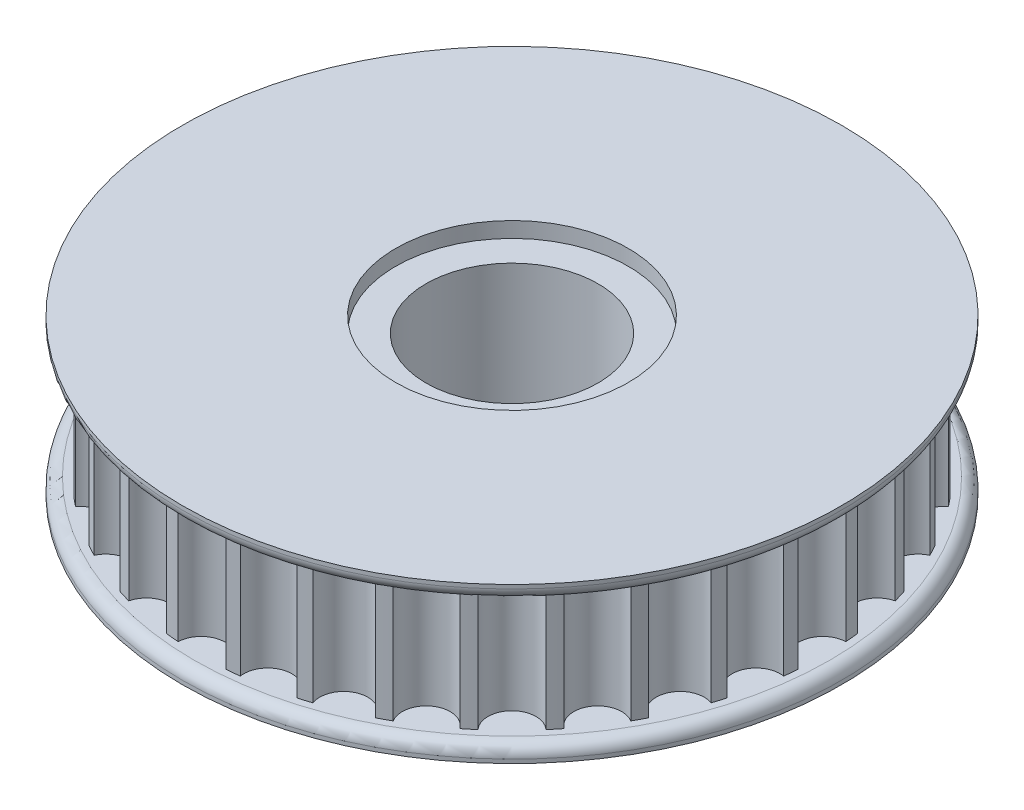
from build123d import *

# Parameters (mm, degrees)
SKETCH1_R           = 11.1
BOSS_EXTRUDE1_DEPTH = 8
SKETCH2_R           = 42.5
SKETCH2_R_2         = 15
BOSS_EXTRUDE2_DEPTH = 2
FILLET1_R           = 1.5


with BuildPart() as part:
    # Sketch1 → Boss-Extrude1 (new, symmetric)
    with BuildSketch(Plane(origin=(0, 0, 0), x_dir=(1, 0, 0), z_dir=(0, 1, 0))):
        with BuildLine():
            ThreePointArc((39.96011477, -3.097680993), (36.98, 0), (39.96011477, 3.097680993))
            ThreePointArc((39.96011477, 3.097680993), (39.887003845, 3.928526984), (39.796619952, 4.757671737))
            ThreePointArc((39.796619952, 4.757671737), (36.269439669, 7.214440108), (38.587964788, 10.833991579))
            ThreePointArc((38.587964788, 10.833991579), (38.354168656, 11.634609864), (38.103763348, 12.430189811))
            ThreePointArc((38.103763348, 12.430189811), (34.165065112, 14.151633329), (35.732900959, 18.153957945))
            ThreePointArc((35.732900959, 18.153957945), (35.347404275, 18.893581212), (34.946600487, 19.625022661))
            ThreePointArc((34.946600487, 19.625022661), (30.747746263, 20.544987217), (31.504641785, 24.776277888))
            ThreePointArc((31.504641785, 24.776277888), (30.982258971, 25.426482829), (30.446459367, 26.065676895))
            ThreePointArc((30.446459367, 26.065676895), (26.148808768, 26.148808768), (26.065676895, 30.446459367))
            ThreePointArc((26.065676895, 30.446459367), (25.426482829, 30.982258971), (24.776277888, 31.504641785))
            ThreePointArc((24.776277888, 31.504641785), (20.544987217, 30.747746263), (19.625022661, 34.946600487))
            ThreePointArc((19.625022661, 34.946600487), (18.893581212, 35.347404275), (18.153957945, 35.732900959))
            ThreePointArc((18.153957945, 35.732900959), (14.151633329, 34.165065112), (12.430189811, 38.103763348))
            ThreePointArc((12.430189811, 38.103763348), (11.634609864, 38.354168656), (10.833991579, 38.587964788))
            ThreePointArc((10.833991579, 38.587964788), (7.214440108, 36.269439669), (4.757671737, 39.796619952))
            ThreePointArc((4.757671737, 39.796619952), (3.928526984, 39.887003845), (3.097680993, 39.96011477))
            ThreePointArc((3.097680993, 39.96011477), (0, 36.98), (-3.097680993, 39.96011477))
            ThreePointArc((-3.097680993, 39.96011477), (-3.928526984, 39.887003845), (-4.757671737, 39.796619952))
            ThreePointArc((-4.757671737, 39.796619952), (-7.214440108, 36.269439669), (-10.833991579, 38.587964788))
            ThreePointArc((-10.833991579, 38.587964788), (-11.634609864, 38.354168656), (-12.430189811, 38.103763348))
            ThreePointArc((-12.430189811, 38.103763348), (-14.151633329, 34.165065112), (-18.153957945, 35.732900959))
            ThreePointArc((-18.153957945, 35.732900959), (-18.893581212, 35.347404275), (-19.625022661, 34.946600487))
            ThreePointArc((-19.625022661, 34.946600487), (-20.544987217, 30.747746263), (-24.776277888, 31.504641785))
            ThreePointArc((-24.776277888, 31.504641785), (-25.426482829, 30.982258971), (-26.065676895, 30.446459367))
            ThreePointArc((-26.065676895, 30.446459367), (-26.148808768, 26.148808768), (-30.446459367, 26.065676895))
            ThreePointArc((-30.446459367, 26.065676895), (-30.982258971, 25.426482829), (-31.504641785, 24.776277888))
            ThreePointArc((-31.504641785, 24.776277888), (-30.747746263, 20.544987217), (-34.946600487, 19.625022661))
            ThreePointArc((-34.946600487, 19.625022661), (-35.347404275, 18.893581212), (-35.732900959, 18.153957945))
            ThreePointArc((-35.732900959, 18.153957945), (-34.165065112, 14.151633329), (-38.103763348, 12.430189811))
            ThreePointArc((-38.103763348, 12.430189811), (-38.354168656, 11.634609864), (-38.587964788, 10.833991579))
            ThreePointArc((-38.587964788, 10.833991579), (-36.269439669, 7.214440108), (-39.796619952, 4.757671737))
            ThreePointArc((-39.796619952, 4.757671737), (-39.887003845, 3.928526984), (-39.96011477, 3.097680993))
            ThreePointArc((-39.96011477, 3.097680993), (-36.98, 0), (-39.96011477, -3.097680993))
            ThreePointArc((-39.96011477, -3.097680993), (-39.887003845, -3.928526984), (-39.796619952, -4.757671737))
            ThreePointArc((-39.796619952, -4.757671737), (-36.269439669, -7.214440108), (-38.587964788, -10.833991579))
            ThreePointArc((-38.587964788, -10.833991579), (-38.354168656, -11.634609864), (-38.103763348, -12.430189811))
            ThreePointArc((-38.103763348, -12.430189811), (-34.165065112, -14.151633329), (-35.732900959, -18.153957945))
            ThreePointArc((-35.732900959, -18.153957945), (-35.347404275, -18.893581212), (-34.946600487, -19.625022661))
            ThreePointArc((-34.946600487, -19.625022661), (-30.747746263, -20.544987217), (-31.504641785, -24.776277888))
            ThreePointArc((-31.504641785, -24.776277888), (-30.982258971, -25.426482829), (-30.446459367, -26.065676895))
            ThreePointArc((-30.446459367, -26.065676895), (-26.148808768, -26.148808768), (-26.065676895, -30.446459367))
            ThreePointArc((-26.065676895, -30.446459367), (-25.426482829, -30.982258971), (-24.776277888, -31.504641785))
            ThreePointArc((-24.776277888, -31.504641785), (-20.544987217, -30.747746263), (-19.625022661, -34.946600487))
            ThreePointArc((-19.625022661, -34.946600487), (-18.893581212, -35.347404275), (-18.153957945, -35.732900959))
            ThreePointArc((-18.153957945, -35.732900959), (-14.151633329, -34.165065112), (-12.430189811, -38.103763348))
            ThreePointArc((-12.430189811, -38.103763348), (-11.634609864, -38.354168656), (-10.833991579, -38.587964788))
            ThreePointArc((-10.833991579, -38.587964788), (-7.214440108, -36.269439669), (-4.757671737, -39.796619952))
            ThreePointArc((-4.757671737, -39.796619952), (-3.928526984, -39.887003845), (-3.097680993, -39.96011477))
            ThreePointArc((-3.097680993, -39.96011477), (0, -36.98), (3.097680993, -39.96011477))
            ThreePointArc((3.097680993, -39.96011477), (3.928526984, -39.887003845), (4.757671737, -39.796619952))
            ThreePointArc((4.757671737, -39.796619952), (7.214440108, -36.269439669), (10.833991579, -38.587964788))
            ThreePointArc((10.833991579, -38.587964788), (11.634609864, -38.354168656), (12.430189811, -38.103763348))
            ThreePointArc((12.430189811, -38.103763348), (14.151633329, -34.165065112), (18.153957945, -35.732900959))
            ThreePointArc((18.153957945, -35.732900959), (18.893581212, -35.347404275), (19.625022661, -34.946600487))
            ThreePointArc((19.625022661, -34.946600487), (20.544987217, -30.747746263), (24.776277888, -31.504641785))
            ThreePointArc((24.776277888, -31.504641785), (25.426482829, -30.982258971), (26.065676895, -30.446459367))
            ThreePointArc((26.065676895, -30.446459367), (26.148808768, -26.148808768), (30.446459367, -26.065676895))
            ThreePointArc((30.446459367, -26.065676895), (30.982258971, -25.426482829), (31.504641785, -24.776277888))
            ThreePointArc((31.504641785, -24.776277888), (30.747746263, -20.544987217), (34.946600487, -19.625022661))
            ThreePointArc((34.946600487, -19.625022661), (35.347404275, -18.893581212), (35.732900959, -18.153957945))
            ThreePointArc((35.732900959, -18.153957945), (34.165065112, -14.151633329), (38.103763348, -12.430189811))
            ThreePointArc((38.103763348, -12.430189811), (38.354168656, -11.634609864), (38.587964788, -10.833991579))
            ThreePointArc((38.587964788, -10.833991579), (36.269439669, -7.214440108), (39.796619952, -4.757671737))
            ThreePointArc((39.796619952, -4.757671737), (39.887003845, -3.928526984), (39.96011477, -3.097680993))
        make_face()
        Circle(SKETCH1_R, mode=Mode.SUBTRACT)
    extrude(amount=BOSS_EXTRUDE1_DEPTH, both=True)

    # Sketch2 → Boss-Extrude2 (add)
    with BuildSketch(Plane(origin=(0, 8, 0), x_dir=(1, 0, 0), z_dir=(0, 1, 0))):
        Circle(SKETCH2_R)
        Circle(SKETCH2_R_2, mode=Mode.SUBTRACT)
    boss_extrude2 = extrude(amount=BOSS_EXTRUDE2_DEPTH)

    # Mirror1: Boss-Extrude2 across plane
    add(boss_extrude2.mirror(Plane.ZX))

    # Fillet1
    fillet1_edges = [part.edges().sort_by_distance(p)[0] for p in [
        (-42.5, 8, 0),
        (-42.5, -8, 0),
    ]]
    fillet(fillet1_edges, radius=FILLET1_R)


solid = part.part
